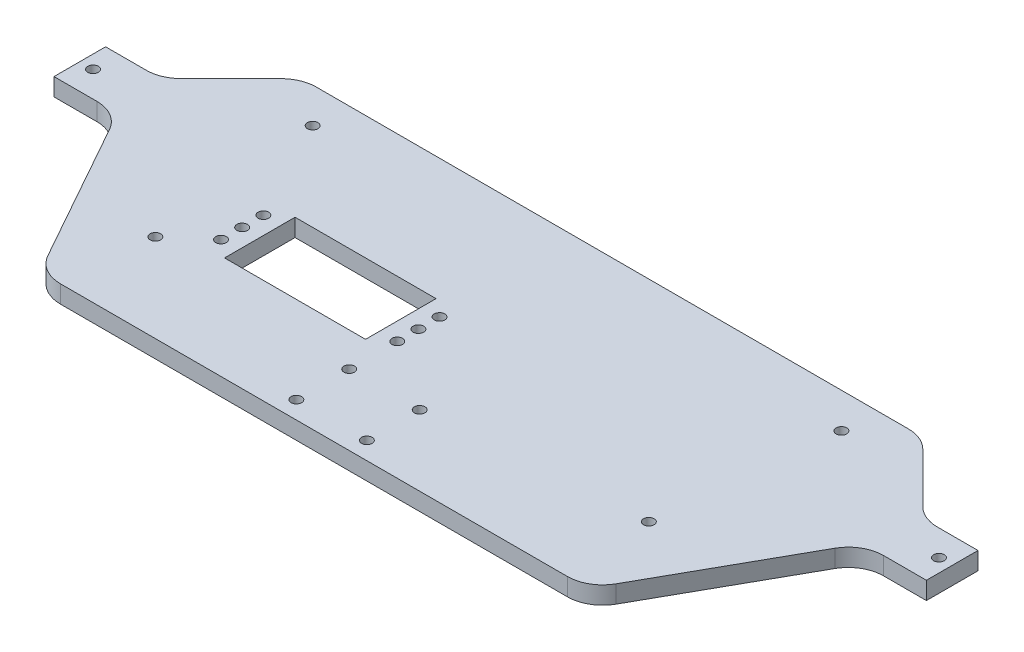
from build123d import *

# Parameters (mm, degrees)
SALIENTE_EXTRUIR1_DEPTH = 5
REDONDEO1_R             = 10
CROQUIS2_R              = 1.5
CROQUIS2_W              = 40
CROQUIS2_H              = 20
CORTAR_EXTRUIR1_DEPTH   = 135.669558943
CROQUIS3_W              = 4
CROQUIS3_H              = 14.636342218
CORTAR_EXTRUIR2_DEPTH   = 135.669558943


with BuildPart() as part:
    # Croquis1 → Saliente-Extruir1 (new body)
    with BuildSketch(Plane(origin=(0, 0, 0), x_dir=(1, 0, 0), z_dir=(0, 1, 0))):
        Polygon((-88.1, 42.318171109), (88.1, 42.318171109), (108.1, 22.318171109), (127.75, 22.318171109), (127.75, 7.681828891), (105.75, 7.681828891), (77.75, -42.318171109), (-77.75, -42.318171109), (-105.75, 7.681828891), (-127.75, 7.681828891), (-127.75, 22.318171109), (-108.1, 22.318171109), align=None)
    extrude(amount=SALIENTE_EXTRUIR1_DEPTH)

    # Redondeo1
    redondeo1_edges = [part.edges().sort_by_distance(p)[0] for p in [
        (88.1, 2.5, -42.318171109),
        (-88.1, 2.5, -42.318171109),
        (-77.75, 2.5, 42.318171109),
        (77.75, 2.5, 42.318171109),
        (108.1, 2.5, -22.318171109),
        (105.75, 2.5, -7.681828891),
        (-105.75, 2.5, -7.681828891),
        (-108.1, 2.5, -22.318171109),
    ]]
    fillet(redondeo1_edges, radius=REDONDEO1_R)

    # Croquis2 → Cortar-Extruir1 (cut, through all)
    with BuildSketch(Plane(origin=(0, 5, 0), x_dir=(1, 0, 0), z_dir=(0, 1, 0))):
        with Locations((70, -17.318171109)):
            Circle(CROQUIS2_R)
        with Locations((-70, -17.318171109)):
            Circle(CROQUIS2_R)
        with Locations((-119.996067812, 15)):
            Circle(CROQUIS2_R)
        with Locations((119.996067812, 15)):
            Circle(CROQUIS2_R)
        with Locations((-75, 32.318171109)):
            Circle(CROQUIS2_R)
        with Locations((75, 32.318171109)):
            Circle(CROQUIS2_R)
        with Locations((-10, -22.318171109)):
            Circle(CROQUIS2_R)
        with Locations((10, -22.318171109)):
            Circle(CROQUIS2_R)
        with Locations((-10, -37.318171109)):
            Circle(CROQUIS2_R)
        with Locations((10, -37.318171109)):
            Circle(CROQUIS2_R)
        with Locations((-60, -2.681828891)):
            Circle(CROQUIS2_R)
        with Locations((-10, -2.681828891)):
            Circle(CROQUIS2_R)
        with Locations((-60, 3.318171109)):
            Circle(CROQUIS2_R)
        with Locations((-60, -8.681828891)):
            Circle(CROQUIS2_R)
        with Locations((-10, 3.318171109)):
            Circle(CROQUIS2_R)
        with Locations((-10, -8.681828891)):
            Circle(CROQUIS2_R)
        with Locations((-35, -2.681828891)):
            Rectangle(CROQUIS2_W, CROQUIS2_H)
    extrude(amount=-CORTAR_EXTRUIR1_DEPTH, mode=Mode.SUBTRACT)

    # Croquis3 → Cortar-Extruir2 (cut, through all)
    with BuildSketch(Plane(origin=(0, 5, 0), x_dir=(1, 0, 0), z_dir=(0, 1, 0))):
        with Locations((-125.75, 15)):
            Rectangle(CROQUIS3_W, CROQUIS3_H)
        with Locations((125.75, 15)):
            Rectangle(CROQUIS3_W, CROQUIS3_H)
    extrude(amount=-CORTAR_EXTRUIR2_DEPTH, mode=Mode.SUBTRACT)


solid = part.part
